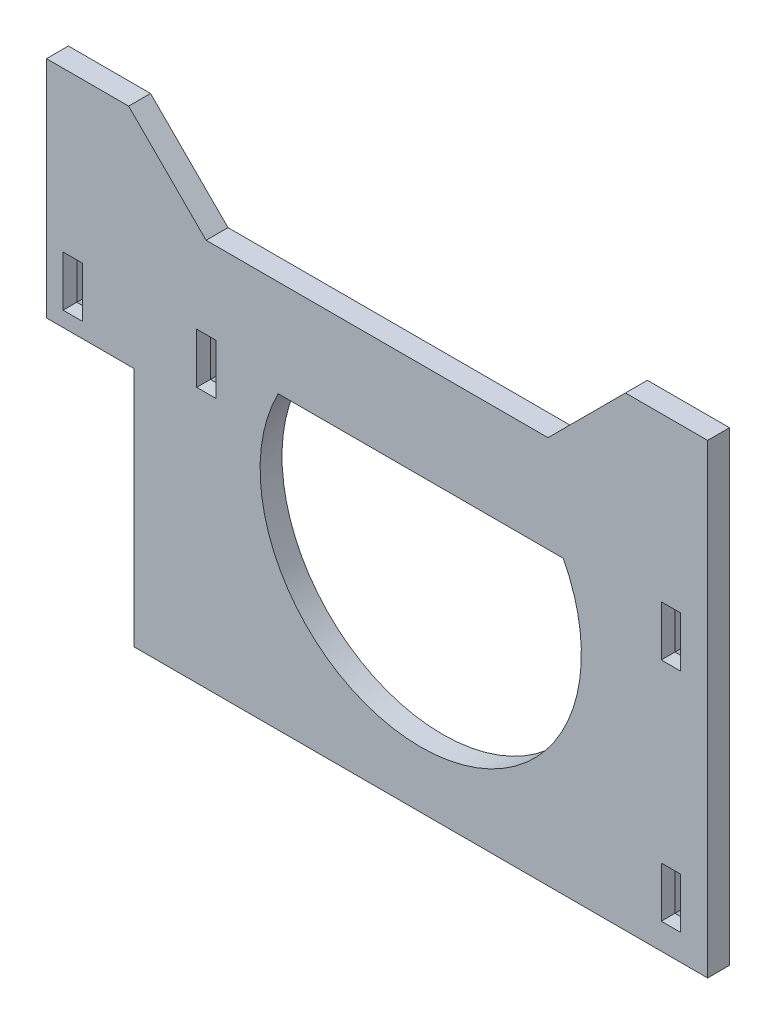
from build123d import *
from OCP.BRepFilletAPI import BRepFilletAPI_MakeChamfer

# Parameters (mm, degrees)
SKETCH1_W           = 3.53
SKETCH1_H           = 9.2
BOSS_EXTRUDE1_DEPTH = 4
BOSS_EXTRUDE2_DEPTH = 4
CHAMFER1_SIZE       = 1.5
CHAMFER1_SIZE2      = 0.5


with BuildPart() as part:
    # Sketch1 → Boss-Extrude1 (new body)
    with BuildSketch(Plane.XY):
        Polygon((52.4925, 30), (52.4925, -30), (-52.2075, -30), (-52.2075, 14), (-68.2075, 14), (-68.2075, 30), align=None)
        with BuildLine():
            Line((-25.900000003, 23.179137901), (26.135555553, 23.179137901))
            ThreePointArc((26.135555553, 23.179137901), (0.117777775, -19.676914391), (-25.900000003, 23.179137901))
        make_face(mode=Mode.SUBTRACT)
        with Locations((-39.0075, 21.35)):
            Rectangle(SKETCH1_W, SKETCH1_H, mode=Mode.SUBTRACT)
        with Locations((45.7925, 20.65)):
            Rectangle(SKETCH1_W, SKETCH1_H, mode=Mode.SUBTRACT)
        with Locations((45.8, -20.65)):
            Rectangle(SKETCH1_W, SKETCH1_H, mode=Mode.SUBTRACT)
        with Locations((-63.4075, 21.35)):
            Rectangle(SKETCH1_W, SKETCH1_H, mode=Mode.SUBTRACT)
    extrude(amount=BOSS_EXTRUDE1_DEPTH)

    # Sketch2 → Boss-Extrude2 (add)
    with BuildSketch(Plane.XY):
        Polygon((-68.2075, 30), (52.4925, 30), (52.4925, 55), (37.4925, 55), (23.350364376, 40.857864376), (-39.065364376, 40.857864376), (-53.2075, 55), (-68.2075, 55), align=None)
    extrude(amount=BOSS_EXTRUDE2_DEPTH)

    # Chamfer1: one chamfer whose edges measure the first distance from different faces: ONE call of the kernel's chamfer builder (chamfer() names one face for all edges)
    chamfer1_edges_1 = [part.edges().sort_by_distance(p)[0] for p in [
        (45.8, -25.25, 0),
    ]]
    chamfer1_side_1 = [part.faces().sort_by_distance(p)[0] for p in [
        (45.8, -25.25, 2),
    ]]
    chamfer1_edges_2 = [part.edges().sort_by_distance(p)[0] for p in [
        (44.035, -20.65, 0),
    ]]
    chamfer1_side_2 = [part.faces().sort_by_distance(p)[0] for p in [
        (44.035, -20.65, 2),
    ]]
    chamfer1_edges_3 = [part.edges().sort_by_distance(p)[0] for p in [
        (45.8, -16.05, 0),
    ]]
    chamfer1_side_3 = [part.faces().sort_by_distance(p)[0] for p in [
        (45.8, -16.05, 2),
    ]]
    chamfer1_edges_4 = [part.edges().sort_by_distance(p)[0] for p in [
        (47.565, -20.65, 0),
    ]]
    chamfer1_side_4 = [part.faces().sort_by_distance(p)[0] for p in [
        (47.565, -20.65, 2),
    ]]
    chamfer1_edges_5 = [part.edges().sort_by_distance(p)[0] for p in [
        (-63.4075, 25.95, 0),
    ]]
    chamfer1_side_5 = [part.faces().sort_by_distance(p)[0] for p in [
        (-63.4075, 25.95, 2),
    ]]
    chamfer1_edges_6 = [part.edges().sort_by_distance(p)[0] for p in [
        (-61.6425, 21.35, 0),
    ]]
    chamfer1_side_6 = [part.faces().sort_by_distance(p)[0] for p in [
        (-61.6425, 21.35, 2),
    ]]
    chamfer1_edges_7 = [part.edges().sort_by_distance(p)[0] for p in [
        (-63.4075, 16.75, 0),
    ]]
    chamfer1_side_7 = [part.faces().sort_by_distance(p)[0] for p in [
        (-63.4075, 16.75, 2),
    ]]
    chamfer1_edges_8 = [part.edges().sort_by_distance(p)[0] for p in [
        (-65.1725, 21.35, 0),
    ]]
    chamfer1_side_8 = [part.faces().sort_by_distance(p)[0] for p in [
        (-65.1725, 21.35, 2),
    ]]
    chamfer1_edges_9 = [part.edges().sort_by_distance(p)[0] for p in [
        (-39.0075, 25.95, 0),
    ]]
    chamfer1_side_9 = [part.faces().sort_by_distance(p)[0] for p in [
        (-39.0075, 25.95, 2),
    ]]
    chamfer1_edges_10 = [part.edges().sort_by_distance(p)[0] for p in [
        (-37.2425, 21.35, 0),
    ]]
    chamfer1_side_10 = [part.faces().sort_by_distance(p)[0] for p in [
        (-37.2425, 21.35, 2),
    ]]
    chamfer1_edges_11 = [part.edges().sort_by_distance(p)[0] for p in [
        (-39.0075, 16.75, 0),
    ]]
    chamfer1_side_11 = [part.faces().sort_by_distance(p)[0] for p in [
        (-39.0075, 16.75, 2),
    ]]
    chamfer1_edges_12 = [part.edges().sort_by_distance(p)[0] for p in [
        (-40.7725, 21.35, 0),
    ]]
    chamfer1_side_12 = [part.faces().sort_by_distance(p)[0] for p in [
        (-40.7725, 21.35, 2),
    ]]
    chamfer1_edges_13 = [part.edges().sort_by_distance(p)[0] for p in [
        (45.7925, 25.25, 0),
    ]]
    chamfer1_side_13 = [part.faces().sort_by_distance(p)[0] for p in [
        (45.7925, 25.25, 2),
    ]]
    chamfer1_edges_14 = [part.edges().sort_by_distance(p)[0] for p in [
        (47.5575, 20.65, 0),
    ]]
    chamfer1_side_14 = [part.faces().sort_by_distance(p)[0] for p in [
        (47.5575, 20.65, 2),
    ]]
    chamfer1_edges_15 = [part.edges().sort_by_distance(p)[0] for p in [
        (45.7925, 16.05, 0),
    ]]
    chamfer1_side_15 = [part.faces().sort_by_distance(p)[0] for p in [
        (45.7925, 16.05, 2),
    ]]
    chamfer1_edges_16 = [part.edges().sort_by_distance(p)[0] for p in [
        (44.0275, 20.65, 0),
    ]]
    chamfer1_side_16 = [part.faces().sort_by_distance(p)[0] for p in [
        (44.0275, 20.65, 2),
    ]]
    chamfer1 = BRepFilletAPI_MakeChamfer(part.part.solid().wrapped)
    for e in chamfer1_edges_1:
        chamfer1.Add(CHAMFER1_SIZE, CHAMFER1_SIZE2, e.wrapped, chamfer1_side_1[0].wrapped)  # the first distance lies on this face
    for e in chamfer1_edges_2:
        chamfer1.Add(CHAMFER1_SIZE, CHAMFER1_SIZE2, e.wrapped, chamfer1_side_2[0].wrapped)  # the first distance lies on this face
    for e in chamfer1_edges_3:
        chamfer1.Add(CHAMFER1_SIZE, CHAMFER1_SIZE2, e.wrapped, chamfer1_side_3[0].wrapped)  # the first distance lies on this face
    for e in chamfer1_edges_4:
        chamfer1.Add(CHAMFER1_SIZE, CHAMFER1_SIZE2, e.wrapped, chamfer1_side_4[0].wrapped)  # the first distance lies on this face
    for e in chamfer1_edges_5:
        chamfer1.Add(CHAMFER1_SIZE, CHAMFER1_SIZE2, e.wrapped, chamfer1_side_5[0].wrapped)  # the first distance lies on this face
    for e in chamfer1_edges_6:
        chamfer1.Add(CHAMFER1_SIZE, CHAMFER1_SIZE2, e.wrapped, chamfer1_side_6[0].wrapped)  # the first distance lies on this face
    for e in chamfer1_edges_7:
        chamfer1.Add(CHAMFER1_SIZE, CHAMFER1_SIZE2, e.wrapped, chamfer1_side_7[0].wrapped)  # the first distance lies on this face
    for e in chamfer1_edges_8:
        chamfer1.Add(CHAMFER1_SIZE, CHAMFER1_SIZE2, e.wrapped, chamfer1_side_8[0].wrapped)  # the first distance lies on this face
    for e in chamfer1_edges_9:
        chamfer1.Add(CHAMFER1_SIZE, CHAMFER1_SIZE2, e.wrapped, chamfer1_side_9[0].wrapped)  # the first distance lies on this face
    for e in chamfer1_edges_10:
        chamfer1.Add(CHAMFER1_SIZE, CHAMFER1_SIZE2, e.wrapped, chamfer1_side_10[0].wrapped)  # the first distance lies on this face
    for e in chamfer1_edges_11:
        chamfer1.Add(CHAMFER1_SIZE, CHAMFER1_SIZE2, e.wrapped, chamfer1_side_11[0].wrapped)  # the first distance lies on this face
    for e in chamfer1_edges_12:
        chamfer1.Add(CHAMFER1_SIZE, CHAMFER1_SIZE2, e.wrapped, chamfer1_side_12[0].wrapped)  # the first distance lies on this face
    for e in chamfer1_edges_13:
        chamfer1.Add(CHAMFER1_SIZE, CHAMFER1_SIZE2, e.wrapped, chamfer1_side_13[0].wrapped)  # the first distance lies on this face
    for e in chamfer1_edges_14:
        chamfer1.Add(CHAMFER1_SIZE, CHAMFER1_SIZE2, e.wrapped, chamfer1_side_14[0].wrapped)  # the first distance lies on this face
    for e in chamfer1_edges_15:
        chamfer1.Add(CHAMFER1_SIZE, CHAMFER1_SIZE2, e.wrapped, chamfer1_side_15[0].wrapped)  # the first distance lies on this face
    for e in chamfer1_edges_16:
        chamfer1.Add(CHAMFER1_SIZE, CHAMFER1_SIZE2, e.wrapped, chamfer1_side_16[0].wrapped)  # the first distance lies on this face
    add(Compound.cast(chamfer1.Shape()), mode=Mode.REPLACE)


solid = part.part
